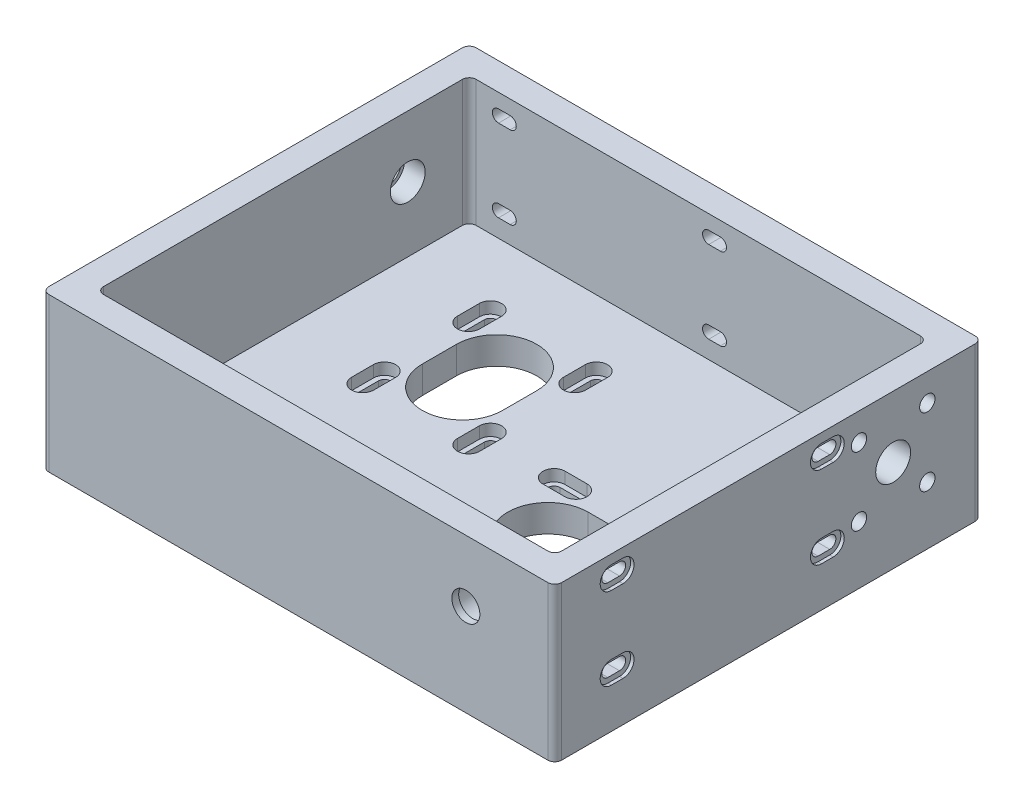
from build123d import *

# Parameters (mm, degrees)
SKETCH_1_W               = 150
SKETCH_1_H               = 125
EXTRUDE_1_DEPTH          = 45
SHELL_1_T                = -8
CUT_EXTRUDE_1_REACH      = 154.561
SKETCH_5_R               = 5.1
SKETCH_6_R               = 5.1
CUT_EXTRUDE_2_DEPTH      = 169.615687289
CUT_EXTRUDE_3_DEPTH      = 105.404262365
HOLE_WIZARD_M3_2_DEPTH   = 8
HOLE_START               = 4.6
HOLE_WIZARD_M3_2_2_DEPTH = 3.4
HOLE_WIZARD_M3_1_DEPTH   = 8
HOLE_WIZARD_M3_1_2_DEPTH = 3.4
HOLE_START_2             = -62.5
HOLE_WIZARD_M3_4_DEPTH   = 8
HOLE_WIZARD_M3_4_2_DEPTH = 1
HOLE_START_3             = 67
HOLE_WIZARD_M3_5_DEPTH   = 8
HOLE_START_4             = 74
HOLE_WIZARD_M3_5_2_DEPTH = 1
FILLET_1_R               = 2
FILLET_2_R               = 2
CUT_EXTRUDE_4_REACH      = 170.616
SKETCH_17_R              = 2.25
SKETCH_18_R              = 5.1
SKETCH_18_R_2            = 4.1
EXTRUDE_2_DEPTH          = 2
SKETCH_19_R              = 5.1
SKETCH_19_R_2            = 4.1
EXTRUDE_3_DEPTH          = 2


# Read off the part's stored shape, not the designer's step: M3 六角承窩頭蓋螺釘的柱孔2, M3 六角承窩頭蓋螺釘的柱孔1, M3 六角承窩頭蓋螺釘的柱孔4, M3 六角承窩頭蓋螺釘的柱孔5
with BuildPart() as part:
    # 草圖1 → 填料-伸長1 (new body)
    with BuildSketch(Plane(origin=(0, 0, 0), x_dir=(1, 0, 0), z_dir=(0, 1, 0))):
        Rectangle(SKETCH_1_W, SKETCH_1_H)
    extrude(amount=EXTRUDE_1_DEPTH)

    # 薄殼1
    shell_1_openings = [part.faces().sort_by_distance(p)[0] for p in [
        (0, 45, 0),
    ]]
    offset(amount=SHELL_1_T, openings=shell_1_openings, kind=Kind.INTERSECTION)

    # 草圖5 → 除料-伸長1 (cut, up to next)
    with BuildSketch(Plane.XY.offset(62.5), mode=Mode.PRIVATE) as cut_extrude_1_sk1:
        with Locations((49, 27)):
            Circle(SKETCH_5_R)
    cut_extrude_1_tool1 = extrude(cut_extrude_1_sk1.sketch, amount=-CUT_EXTRUDE_1_REACH, mode=Mode.PRIVATE) & part.part
    add(cut_extrude_1_tool1.solids().sort_by_distance((49, 27, 62.5))[0], mode=Mode.SUBTRACT)

    # 草圖6 → 除料-伸長2 (cut, through all)
    with BuildSketch(Plane.ZY.offset(75)):
        with Locations((-36.5, 27)):
            Circle(SKETCH_6_R)
    extrude(amount=-CUT_EXTRUDE_2_DEPTH, mode=Mode.SUBTRACT)

    # 草圖7 → 除料-伸長3 (cut, through all)
    with BuildSketch(Plane(origin=(0, 8, 0), x_dir=(1, 0, 0), z_dir=(0, 1, 0))):
        with BuildLine():
            Line((-14.25, 21.5), (-14.25, 11.5))
            ThreePointArc((-14.25, 11.5), (-26, -0.25), (-37.75, 11.5))
            Line((-37.75, 11.5), (-37.75, 21.5))
            ThreePointArc((-37.75, 21.5), (-26, 33.25), (-14.25, 21.5))
        make_face()
        with BuildLine():
            Line((24, -1.75), (34, -1.75))
            ThreePointArc((34, -1.75), (45.75, -13.5), (34, -25.25))
            Line((34, -25.25), (24, -25.25))
            ThreePointArc((24, -25.25), (12.25, -13.5), (24, -1.75))
        make_face()
    extrude(amount=-CUT_EXTRUDE_3_DEPTH, mode=Mode.SUBTRACT)

    # M3 六角承窩頭蓋螺釘的柱孔2 outline → M3 六角承窩頭蓋螺釘的柱孔2 (cut)
    with BuildSketch(Plane(origin=(0, 0, 0), x_dir=(1, 0, 0), z_dir=(0, 1, 0))):
        with BuildLine():
            Line((-39.7, 28.8), (-39.7, 35.2))
            ThreePointArc((-39.7, 35.2), (-41.5, 37), (-43.3, 35.2))
            Line((-43.3, 35.2), (-43.3, 28.8))
            ThreePointArc((-43.3, 28.8), (-41.5, 27), (-39.7, 28.8))
        make_face()
        with BuildLine():
            ThreePointArc((-39.7, 4.2), (-41.5, 6), (-43.3, 4.2))
            Line((-43.3, 4.2), (-43.3, -2.2))
            ThreePointArc((-43.3, -2.2), (-41.5, -4), (-39.7, -2.2))
            Line((-39.7, -2.2), (-39.7, 4.2))
        make_face()
        with BuildLine():
            Line((-8.7, -2.2), (-8.7, 4.2))
            ThreePointArc((-8.7, 4.2), (-10.5, 6), (-12.3, 4.2))
            Line((-12.3, 4.2), (-12.3, -2.2))
            ThreePointArc((-12.3, -2.2), (-10.5, -4), (-8.7, -2.2))
        make_face()
        with BuildLine():
            ThreePointArc((-8.7, 35.2), (-10.5, 37), (-12.3, 35.2))
            Line((-12.3, 35.2), (-12.3, 28.8))
            ThreePointArc((-12.3, 28.8), (-10.5, 27), (-8.7, 28.8))
            Line((-8.7, 28.8), (-8.7, 35.2))
        make_face()
    extrude(amount=HOLE_WIZARD_M3_2_DEPTH, mode=Mode.SUBTRACT)

    # Hole Wizard M3 _2 2 outline → Hole Wizard M3 _2 2 (cut)
    # profile 1 of 4: a face of its own
    with BuildSketch(Plane(origin=(0, 0, 0), x_dir=(1, 0, 0), z_dir=(0, 1, 0)).offset(HOLE_START)):
        with BuildLine():
            Line((-38.25, 28.8), (-38.25, 35.2))
            ThreePointArc((-38.25, 35.2), (-41.5, 38.45), (-44.75, 35.2))
            Line((-44.75, 35.2), (-44.75, 28.8))
            ThreePointArc((-44.75, 28.8), (-41.5, 25.55), (-38.25, 28.8))
        make_face()
        with BuildLine():
            ThreePointArc((-43.3, 35.2), (-41.5, 37), (-39.7, 35.2))
            Line((-39.7, 35.2), (-39.7, 28.8))
            ThreePointArc((-39.7, 28.8), (-41.5, 27), (-43.3, 28.8))
            Line((-43.3, 28.8), (-43.3, 35.2))
        make_face(mode=Mode.SUBTRACT)
    # profile 2 of 4: a face of its own
    with BuildSketch(Plane(origin=(0, 0, 0), x_dir=(1, 0, 0), z_dir=(0, 1, 0)).offset(HOLE_START)):
        with BuildLine():
            ThreePointArc((-38.25, 4.2), (-41.5, 7.45), (-44.75, 4.2))
            Line((-44.75, 4.2), (-44.75, -2.2))
            ThreePointArc((-44.75, -2.2), (-41.5, -5.45), (-38.25, -2.2))
            Line((-38.25, -2.2), (-38.25, 4.2))
        make_face()
        with BuildLine():
            Line((-43.3, -2.2), (-43.3, 4.2))
            ThreePointArc((-43.3, 4.2), (-41.5, 6), (-39.7, 4.2))
            Line((-39.7, 4.2), (-39.7, -2.2))
            ThreePointArc((-39.7, -2.2), (-41.5, -4), (-43.3, -2.2))
        make_face(mode=Mode.SUBTRACT)
    # profile 3 of 4: a face of its own
    with BuildSketch(Plane(origin=(0, 0, 0), x_dir=(1, 0, 0), z_dir=(0, 1, 0)).offset(HOLE_START)):
        with BuildLine():
            Line((-7.25, -2.2), (-7.25, 4.2))
            ThreePointArc((-7.25, 4.2), (-10.5, 7.45), (-13.75, 4.2))
            Line((-13.75, 4.2), (-13.75, -2.2))
            ThreePointArc((-13.75, -2.2), (-10.5, -5.45), (-7.25, -2.2))
        make_face()
        with BuildLine():
            ThreePointArc((-12.3, 4.2), (-10.5, 6), (-8.7, 4.2))
            Line((-8.7, 4.2), (-8.7, -2.2))
            ThreePointArc((-8.7, -2.2), (-10.5, -4), (-12.3, -2.2))
            Line((-12.3, -2.2), (-12.3, 4.2))
        make_face(mode=Mode.SUBTRACT)
    # profile 4 of 4: a face of its own
    with BuildSketch(Plane(origin=(0, 0, 0), x_dir=(1, 0, 0), z_dir=(0, 1, 0)).offset(HOLE_START)):
        with BuildLine():
            ThreePointArc((-7.25, 35.2), (-10.5, 38.45), (-13.75, 35.2))
            Line((-13.75, 35.2), (-13.75, 28.8))
            ThreePointArc((-13.75, 28.8), (-10.5, 25.55), (-7.25, 28.8))
            Line((-7.25, 28.8), (-7.25, 35.2))
        make_face()
        with BuildLine():
            Line((-12.3, 28.8), (-12.3, 35.2))
            ThreePointArc((-12.3, 35.2), (-10.5, 37), (-8.7, 35.2))
            Line((-8.7, 35.2), (-8.7, 28.8))
            ThreePointArc((-8.7, 28.8), (-10.5, 27), (-12.3, 28.8))
        make_face(mode=Mode.SUBTRACT)
    extrude(amount=HOLE_WIZARD_M3_2_2_DEPTH, mode=Mode.SUBTRACT)

    # M3 六角承窩頭蓋螺釘的柱孔1 outline → M3 六角承窩頭蓋螺釘的柱孔1 (cut)
    with BuildSketch(Plane(origin=(0, 0, 0), x_dir=(1, 0, 0), z_dir=(0, 1, 0))):
        with BuildLine():
            Line((10.3, -30.8), (16.7, -30.8))
            ThreePointArc((16.7, -30.8), (18.5, -29), (16.7, -27.2))
            Line((16.7, -27.2), (10.3, -27.2))
            ThreePointArc((10.3, -27.2), (8.5, -29), (10.3, -30.8))
        make_face()
        with BuildLine():
            ThreePointArc((47.7, -30.8), (49.5, -29), (47.7, -27.2))
            Line((47.7, -27.2), (41.3, -27.2))
            ThreePointArc((41.3, -27.2), (39.5, -29), (41.3, -30.8))
            Line((41.3, -30.8), (47.7, -30.8))
        make_face()
        with BuildLine():
            Line((10.3, 0.2), (16.7, 0.2))
            ThreePointArc((16.7, 0.2), (18.5, 2), (16.7, 3.8))
            Line((16.7, 3.8), (10.3, 3.8))
            ThreePointArc((10.3, 3.8), (8.5, 2), (10.3, 0.2))
        make_face()
        with BuildLine():
            ThreePointArc((47.7, 0.2), (49.5, 2), (47.7, 3.8))
            Line((47.7, 3.8), (41.3, 3.8))
            ThreePointArc((41.3, 3.8), (39.5, 2), (41.3, 0.2))
            Line((41.3, 0.2), (47.7, 0.2))
        make_face()
    extrude(amount=HOLE_WIZARD_M3_1_DEPTH, mode=Mode.SUBTRACT)

    # Hole Wizard M3 _1 2 outline → Hole Wizard M3 _1 2 (cut)
    # profile 1 of 4: a face of its own
    with BuildSketch(Plane(origin=(0, 0, 0), x_dir=(1, 0, 0), z_dir=(0, 1, 0)).offset(HOLE_START)):
        with BuildLine():
            Line((10.3, -32.25), (16.7, -32.25))
            ThreePointArc((16.7, -32.25), (19.95, -29), (16.7, -25.75))
            Line((16.7, -25.75), (10.3, -25.75))
            ThreePointArc((10.3, -25.75), (7.05, -29), (10.3, -32.25))
        make_face()
        with BuildLine():
            ThreePointArc((16.7, -27.2), (18.5, -29), (16.7, -30.8))
            Line((16.7, -30.8), (10.3, -30.8))
            ThreePointArc((10.3, -30.8), (8.5, -29), (10.3, -27.2))
            Line((10.3, -27.2), (16.7, -27.2))
        make_face(mode=Mode.SUBTRACT)
    # profile 2 of 4: a face of its own
    with BuildSketch(Plane(origin=(0, 0, 0), x_dir=(1, 0, 0), z_dir=(0, 1, 0)).offset(HOLE_START)):
        with BuildLine():
            ThreePointArc((47.7, -32.25), (50.95, -29), (47.7, -25.75))
            Line((47.7, -25.75), (41.3, -25.75))
            ThreePointArc((41.3, -25.75), (38.05, -29), (41.3, -32.25))
            Line((41.3, -32.25), (47.7, -32.25))
        make_face()
        with BuildLine():
            Line((41.3, -27.2), (47.7, -27.2))
            ThreePointArc((47.7, -27.2), (49.5, -29), (47.7, -30.8))
            Line((47.7, -30.8), (41.3, -30.8))
            ThreePointArc((41.3, -30.8), (39.5, -29), (41.3, -27.2))
        make_face(mode=Mode.SUBTRACT)
    # profile 3 of 4: a face of its own
    with BuildSketch(Plane(origin=(0, 0, 0), x_dir=(1, 0, 0), z_dir=(0, 1, 0)).offset(HOLE_START)):
        with BuildLine():
            Line((10.3, -1.25), (16.7, -1.25))
            ThreePointArc((16.7, -1.25), (19.95, 2), (16.7, 5.25))
            Line((16.7, 5.25), (10.3, 5.25))
            ThreePointArc((10.3, 5.25), (7.05, 2), (10.3, -1.25))
        make_face()
        with BuildLine():
            ThreePointArc((16.7, 3.8), (18.5, 2), (16.7, 0.2))
            Line((16.7, 0.2), (10.3, 0.2))
            ThreePointArc((10.3, 0.2), (8.5, 2), (10.3, 3.8))
            Line((10.3, 3.8), (16.7, 3.8))
        make_face(mode=Mode.SUBTRACT)
    # profile 4 of 4: a face of its own
    with BuildSketch(Plane(origin=(0, 0, 0), x_dir=(1, 0, 0), z_dir=(0, 1, 0)).offset(HOLE_START)):
        with BuildLine():
            ThreePointArc((47.7, -1.25), (50.95, 2), (47.7, 5.25))
            Line((47.7, 5.25), (41.3, 5.25))
            ThreePointArc((41.3, 5.25), (38.05, 2), (41.3, -1.25))
            Line((41.3, -1.25), (47.7, -1.25))
        make_face()
        with BuildLine():
            Line((41.3, 3.8), (47.7, 3.8))
            ThreePointArc((47.7, 3.8), (49.5, 2), (47.7, 0.2))
            Line((47.7, 0.2), (41.3, 0.2))
            ThreePointArc((41.3, 0.2), (39.5, 2), (41.3, 3.8))
        make_face(mode=Mode.SUBTRACT)
    extrude(amount=HOLE_WIZARD_M3_1_2_DEPTH, mode=Mode.SUBTRACT)

    # M3 六角承窩頭蓋螺釘的柱孔4 outline → M3 六角承窩頭蓋螺釘的柱孔4 (cut)
    with BuildSketch(Plane.XY.offset(HOLE_START_2)):
        with BuildLine():
            ThreePointArc((6.45, 13.2), (8.25, 15), (6.45, 16.8))
            Line((6.45, 16.8), (3.05, 16.8))
            ThreePointArc((3.05, 16.8), (1.25, 15), (3.05, 13.2))
            Line((3.05, 13.2), (6.45, 13.2))
        make_face()
        with BuildLine():
            ThreePointArc((-58.45, 16.8), (-60.25, 15), (-58.45, 13.2))
            Line((-58.45, 13.2), (-55.05, 13.2))
            ThreePointArc((-55.05, 13.2), (-53.25, 15), (-55.05, 16.8))
            Line((-55.05, 16.8), (-58.45, 16.8))
        make_face()
        with BuildLine():
            ThreePointArc((6.45, 37.2), (8.25, 39), (6.45, 40.8))
            Line((6.45, 40.8), (3.05, 40.8))
            ThreePointArc((3.05, 40.8), (1.25, 39), (3.05, 37.2))
            Line((3.05, 37.2), (6.45, 37.2))
        make_face()
        with BuildLine():
            ThreePointArc((-58.45, 40.8), (-60.25, 39), (-58.45, 37.2))
            Line((-58.45, 37.2), (-55.05, 37.2))
            ThreePointArc((-55.05, 37.2), (-53.25, 39), (-55.05, 40.8))
            Line((-55.05, 40.8), (-58.45, 40.8))
        make_face()
    extrude(amount=HOLE_WIZARD_M3_4_DEPTH, mode=Mode.SUBTRACT)

    # Hole Wizard M3 _4 2 outline → Hole Wizard M3 _4 2 (cut)
    # profile 1 of 4: a face of its own
    with BuildSketch(Plane.XY.offset(HOLE_START_2)):
        with BuildLine():
            ThreePointArc((6.45, 11.75), (9.7, 15), (6.45, 18.25))
            Line((6.45, 18.25), (3.05, 18.25))
            ThreePointArc((3.05, 18.25), (-0.2, 15), (3.05, 11.75))
            Line((3.05, 11.75), (6.45, 11.75))
        make_face()
        with BuildLine():
            Line((3.05, 16.8), (6.45, 16.8))
            ThreePointArc((6.45, 16.8), (8.25, 15), (6.45, 13.2))
            Line((6.45, 13.2), (3.05, 13.2))
            ThreePointArc((3.05, 13.2), (1.25, 15), (3.05, 16.8))
        make_face(mode=Mode.SUBTRACT)
    # profile 2 of 4: a face of its own
    with BuildSketch(Plane.XY.offset(HOLE_START_2)):
        with BuildLine():
            ThreePointArc((-58.45, 18.25), (-61.7, 15), (-58.45, 11.75))
            Line((-58.45, 11.75), (-55.05, 11.75))
            ThreePointArc((-55.05, 11.75), (-51.8, 15), (-55.05, 18.25))
            Line((-55.05, 18.25), (-58.45, 18.25))
        make_face()
        with BuildLine():
            Line((-55.05, 13.2), (-58.45, 13.2))
            ThreePointArc((-58.45, 13.2), (-60.25, 15), (-58.45, 16.8))
            Line((-58.45, 16.8), (-55.05, 16.8))
            ThreePointArc((-55.05, 16.8), (-53.25, 15), (-55.05, 13.2))
        make_face(mode=Mode.SUBTRACT)
    # profile 3 of 4: a face of its own
    with BuildSketch(Plane.XY.offset(HOLE_START_2)):
        with BuildLine():
            ThreePointArc((6.45, 35.75), (9.7, 39), (6.45, 42.25))
            Line((6.45, 42.25), (3.05, 42.25))
            ThreePointArc((3.05, 42.25), (-0.2, 39), (3.05, 35.75))
            Line((3.05, 35.75), (6.45, 35.75))
        make_face()
        with BuildLine():
            Line((3.05, 40.8), (6.45, 40.8))
            ThreePointArc((6.45, 40.8), (8.25, 39), (6.45, 37.2))
            Line((6.45, 37.2), (3.05, 37.2))
            ThreePointArc((3.05, 37.2), (1.25, 39), (3.05, 40.8))
        make_face(mode=Mode.SUBTRACT)
    # profile 4 of 4: a face of its own
    with BuildSketch(Plane.XY.offset(HOLE_START_2)):
        with BuildLine():
            ThreePointArc((-58.45, 42.25), (-61.7, 39), (-58.45, 35.75))
            Line((-58.45, 35.75), (-55.05, 35.75))
            ThreePointArc((-55.05, 35.75), (-51.8, 39), (-55.05, 42.25))
            Line((-55.05, 42.25), (-58.45, 42.25))
        make_face()
        with BuildLine():
            Line((-55.05, 37.2), (-58.45, 37.2))
            ThreePointArc((-58.45, 37.2), (-60.25, 39), (-58.45, 40.8))
            Line((-58.45, 40.8), (-55.05, 40.8))
            ThreePointArc((-55.05, 40.8), (-53.25, 39), (-55.05, 37.2))
        make_face(mode=Mode.SUBTRACT)
    extrude(amount=HOLE_WIZARD_M3_4_2_DEPTH, mode=Mode.SUBTRACT)

    # M3 六角承窩頭蓋螺釘的柱孔5 outline → M3 六角承窩頭蓋螺釘的柱孔5 (cut)
    with BuildSketch(Plane.YZ.offset(HOLE_START_3)):
        with BuildLine():
            ThreePointArc((16.8, 45.95), (15, 47.75), (13.2, 45.95))
            Line((13.2, 45.95), (13.2, 42.55))
            ThreePointArc((13.2, 42.55), (15, 40.75), (16.8, 42.55))
            Line((16.8, 42.55), (16.8, 45.95))
        make_face()
        with BuildLine():
            ThreePointArc((16.8, -15.55), (15, -13.75), (13.2, -15.55))
            Line((13.2, -15.55), (13.2, -18.95))
            ThreePointArc((13.2, -18.95), (15, -20.75), (16.8, -18.95))
            Line((16.8, -18.95), (16.8, -15.55))
        make_face()
        with BuildLine():
            ThreePointArc((40.8, 45.95), (39, 47.75), (37.2, 45.95))
            Line((37.2, 45.95), (37.2, 42.55))
            ThreePointArc((37.2, 42.55), (39, 40.75), (40.8, 42.55))
            Line((40.8, 42.55), (40.8, 45.95))
        make_face()
        with BuildLine():
            ThreePointArc((40.8, -15.55), (39, -13.75), (37.2, -15.55))
            Line((37.2, -15.55), (37.2, -18.95))
            ThreePointArc((37.2, -18.95), (39, -20.75), (40.8, -18.95))
            Line((40.8, -18.95), (40.8, -15.55))
        make_face()
    extrude(amount=HOLE_WIZARD_M3_5_DEPTH, mode=Mode.SUBTRACT)

    # Hole Wizard M3 _5 2 outline → Hole Wizard M3 _5 2 (cut)
    # profile 1 of 4: a face of its own
    with BuildSketch(Plane.YZ.offset(HOLE_START_4)):
        with BuildLine():
            ThreePointArc((18.25, 45.95), (15, 49.2), (11.75, 45.95))
            Line((11.75, 45.95), (11.75, 42.55))
            ThreePointArc((11.75, 42.55), (15, 39.3), (18.25, 42.55))
            Line((18.25, 42.55), (18.25, 45.95))
        make_face()
        with BuildLine():
            Line((13.2, 42.55), (13.2, 45.95))
            ThreePointArc((13.2, 45.95), (15, 47.75), (16.8, 45.95))
            Line((16.8, 45.95), (16.8, 42.55))
            ThreePointArc((16.8, 42.55), (15, 40.75), (13.2, 42.55))
        make_face(mode=Mode.SUBTRACT)
    # profile 2 of 4: a face of its own
    with BuildSketch(Plane.YZ.offset(HOLE_START_4)):
        with BuildLine():
            ThreePointArc((18.25, -15.55), (15, -12.3), (11.75, -15.55))
            Line((11.75, -15.55), (11.75, -18.95))
            ThreePointArc((11.75, -18.95), (15, -22.2), (18.25, -18.95))
            Line((18.25, -18.95), (18.25, -15.55))
        make_face()
        with BuildLine():
            Line((13.2, -18.95), (13.2, -15.55))
            ThreePointArc((13.2, -15.55), (15, -13.75), (16.8, -15.55))
            Line((16.8, -15.55), (16.8, -18.95))
            ThreePointArc((16.8, -18.95), (15, -20.75), (13.2, -18.95))
        make_face(mode=Mode.SUBTRACT)
    # profile 3 of 4: a face of its own
    with BuildSketch(Plane.YZ.offset(HOLE_START_4)):
        with BuildLine():
            ThreePointArc((42.25, 45.95), (39, 49.2), (35.75, 45.95))
            Line((35.75, 45.95), (35.75, 42.55))
            ThreePointArc((35.75, 42.55), (39, 39.3), (42.25, 42.55))
            Line((42.25, 42.55), (42.25, 45.95))
        make_face()
        with BuildLine():
            Line((37.2, 42.55), (37.2, 45.95))
            ThreePointArc((37.2, 45.95), (39, 47.75), (40.8, 45.95))
            Line((40.8, 45.95), (40.8, 42.55))
            ThreePointArc((40.8, 42.55), (39, 40.75), (37.2, 42.55))
        make_face(mode=Mode.SUBTRACT)
    # profile 4 of 4: a face of its own
    with BuildSketch(Plane.YZ.offset(HOLE_START_4)):
        with BuildLine():
            ThreePointArc((42.25, -15.55), (39, -12.3), (35.75, -15.55))
            Line((35.75, -15.55), (35.75, -18.95))
            ThreePointArc((35.75, -18.95), (39, -22.2), (42.25, -18.95))
            Line((42.25, -18.95), (42.25, -15.55))
        make_face()
        with BuildLine():
            Line((37.2, -18.95), (37.2, -15.55))
            ThreePointArc((37.2, -15.55), (39, -13.75), (40.8, -15.55))
            Line((40.8, -15.55), (40.8, -18.95))
            ThreePointArc((40.8, -18.95), (39, -20.75), (37.2, -18.95))
        make_face(mode=Mode.SUBTRACT)
    extrude(amount=HOLE_WIZARD_M3_5_2_DEPTH, mode=Mode.SUBTRACT)

    # 圓角1
    fillet_1_edges = [part.edges().sort_by_distance(p)[0] for p in [
        (67, 26.5, 54.5),
        (67, 26.5, -54.5),
        (-67, 26.5, -54.5),
        (-67, 26.5, 54.5),
    ]]
    fillet(fillet_1_edges, radius=FILLET_1_R)

    # 圓角2
    fillet_2_edges = [part.edges().sort_by_distance(p)[0] for p in [
        (75, 22.5, 62.5),
        (-75, 22.5, 62.5),
        (-75, 22.5, -62.5),
        (75, 22.5, -62.5),
    ]]
    fillet(fillet_2_edges, radius=FILLET_2_R)

    # 草圖17 → 除料-伸長4 (cut, up to next)
    with BuildSketch(Plane(origin=(75, 0, 0), x_dir=(0, 0, -1), z_dir=(1, 0, 0)), mode=Mode.PRIVATE) as cut_extrude_4_sk1:
        with Locations((26.5, 37)):
            Circle(SKETCH_17_R)
    cut_extrude_4_tool1 = extrude(cut_extrude_4_sk1.sketch, amount=-CUT_EXTRUDE_4_REACH, mode=Mode.PRIVATE) & part.part
    # 草圖17 → 除料-伸長4 (cut, up to next)
    with BuildSketch(Plane(origin=(75, 0, 0), x_dir=(0, 0, -1), z_dir=(1, 0, 0)), mode=Mode.PRIVATE) as cut_extrude_4_sk2:
        with Locations((46.5, 37)):
            Circle(SKETCH_17_R)
    cut_extrude_4_tool2 = extrude(cut_extrude_4_sk2.sketch, amount=-CUT_EXTRUDE_4_REACH, mode=Mode.PRIVATE) & part.part
    # 草圖17 → 除料-伸長4 (cut, up to next)
    with BuildSketch(Plane(origin=(75, 0, 0), x_dir=(0, 0, -1), z_dir=(1, 0, 0)), mode=Mode.PRIVATE) as cut_extrude_4_sk3:
        with Locations((46.5, 17)):
            Circle(SKETCH_17_R)
    cut_extrude_4_tool3 = extrude(cut_extrude_4_sk3.sketch, amount=-CUT_EXTRUDE_4_REACH, mode=Mode.PRIVATE) & part.part
    # 草圖17 → 除料-伸長4 (cut, up to next)
    with BuildSketch(Plane(origin=(75, 0, 0), x_dir=(0, 0, -1), z_dir=(1, 0, 0)), mode=Mode.PRIVATE) as cut_extrude_4_sk4:
        with Locations((26.5, 17)):
            Circle(SKETCH_17_R)
    cut_extrude_4_tool4 = extrude(cut_extrude_4_sk4.sketch, amount=-CUT_EXTRUDE_4_REACH, mode=Mode.PRIVATE) & part.part
    add(cut_extrude_4_tool1.solids().sort_by_distance((75, 37, -26.5))[0], mode=Mode.SUBTRACT)
    add(cut_extrude_4_tool2.solids().sort_by_distance((75, 37, -46.5))[0], mode=Mode.SUBTRACT)
    add(cut_extrude_4_tool3.solids().sort_by_distance((75, 17, -46.5))[0], mode=Mode.SUBTRACT)
    add(cut_extrude_4_tool4.solids().sort_by_distance((75, 17, -26.5))[0], mode=Mode.SUBTRACT)

    # 草圖18 → 填料-伸長2 (add)
    with BuildSketch(Plane.XY.offset(62.5)):
        with Locations((49, 27)):
            Circle(SKETCH_18_R)
        with Locations((49, 27)):
            Circle(SKETCH_18_R_2, mode=Mode.SUBTRACT)
    extrude(amount=-EXTRUDE_2_DEPTH)

    # 草圖19 → 填料-伸長3 (add)
    with BuildSketch(Plane.ZY.offset(75)):
        with Locations((-36.5, 27)):
            Circle(SKETCH_19_R)
        with Locations((-36.5, 27)):
            Circle(SKETCH_19_R_2, mode=Mode.SUBTRACT)
    extrude(amount=-EXTRUDE_3_DEPTH)


solid = part.part
